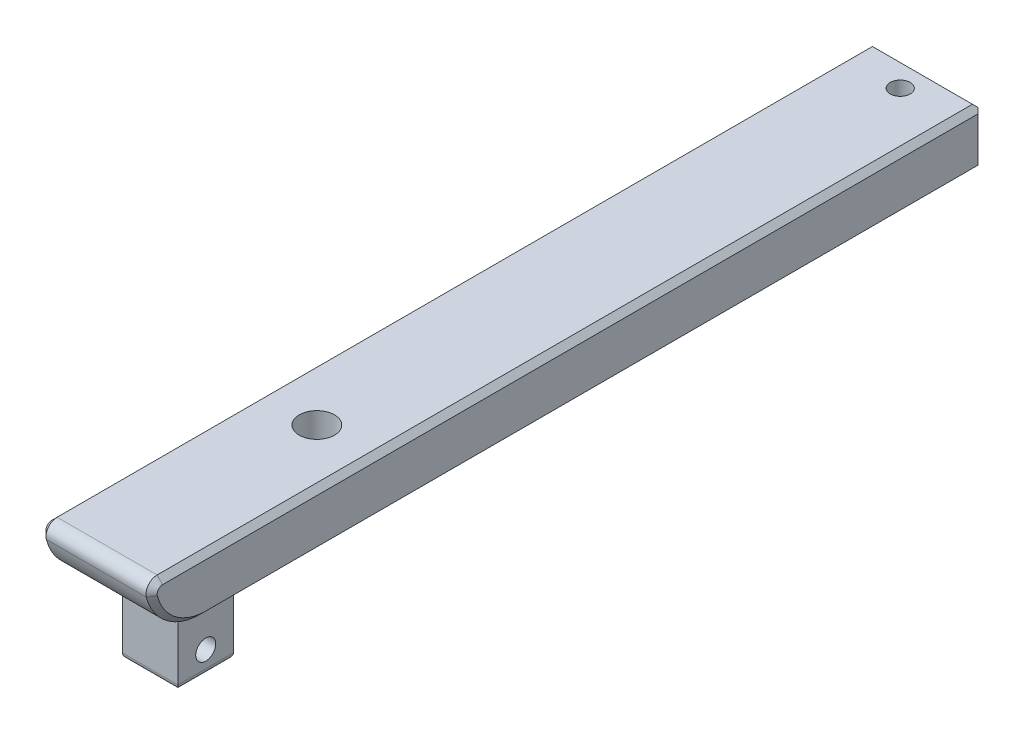
from build123d import *

# Parameters (mm, degrees)
SKETCH1_W                   = 20
SKETCH1_H                   = 150
BOSS_EXTRUDE1_DEPTH         = 10
M3_CLEARANCE_HOLE1_D        = 3.6
SKETCH3_W                   = 10
SKETCH3_H                   = 10
BOSS_EXTRUDE2_DEPTH         = 14
M3_CLEARANCE_HOLE5_D        = 3.6
F_1_4_0_25_DIAMETER_HOLE1_D = 6.35
FILLET1_R                   = 10
FILLET2_R                   = 2
CHAMFER1_SIZE               = 1
FILLET3_R                   = 1
CHAMFER2_SIZE               = 1


with BuildPart() as part:
    # Sketch1 → Boss-Extrude1 (new body)
    with BuildSketch(Plane(origin=(0, 0, 0), x_dir=(1, 0, 0), z_dir=(0, 1, 0))):
        with Locations((10, 75)):
            Rectangle(SKETCH1_W, SKETCH1_H)
    extrude(amount=BOSS_EXTRUDE1_DEPTH)

    # M3 Clearance Hole1 (through all)
    with Locations(Plane(origin=(10, 0, -145), x_dir=(0, 0, -1), z_dir=(0, -1, 0))):
        with Locations((0, 0)):
            Hole(M3_CLEARANCE_HOLE1_D / 2)

    # Sketch3 → Boss-Extrude2 (add)
    with BuildSketch(Plane.XZ):
        with Locations((10, -15)):
            Rectangle(SKETCH3_W, SKETCH3_H)
    extrude(amount=BOSS_EXTRUDE2_DEPTH)

    # M3 Clearance Hole5 (through all)
    with Locations(Plane(origin=(5, -10, -15), x_dir=(0, 0, -1), z_dir=(-1, 0, 0))):
        with Locations((0, 0)):
            Hole(M3_CLEARANCE_HOLE5_D / 2)

    # 1/4 (0.25) Diameter Hole1 (through all)
    with Locations(Plane(origin=(10, 0, -40), x_dir=(0, 0, -1), z_dir=(0, -1, 0))):
        with Locations((0, 0)):
            Hole(F_1_4_0_25_DIAMETER_HOLE1_D / 2)

    # Fillet1
    fillet1_edges = [part.edges().sort_by_distance(p)[0] for p in [
        (10, 0, 0),
    ]]
    fillet(fillet1_edges, radius=FILLET1_R - 0.0001)  # a hair under: the kernel refuses the full size

    # Fillet2
    fillet2_edges = [part.edges().sort_by_distance(p)[0] for p in [
        (10, 10, 0),
    ]]
    fillet(fillet2_edges, radius=FILLET2_R)

    # Chamfer1
    chamfer1_edges = [part.edges().sort_by_distance(p)[0] for p in [
        (20, 0, -79.99995),
        (0, 2.094314553, -3.876198607),
        (20, 10, -76.127005384),
        (0, 10, -76.127005384),
        (20, 2.094314553, -3.876198607),
        (20, 9.224752526, -0.672877867),
        (0, 9.224752526, -0.672877867),
        (0, 0, -79.99995),
        (0, 5, -150),
        (20, 5, -150),
    ]]
    chamfer(chamfer1_edges, length=CHAMFER1_SIZE)

    # Fillet3
    fillet3_edges = [part.edges().sort_by_distance(p)[0] for p in [
        (5, -14, -15),
        (10, -14, -20),
        (15, -14, -15),
        (10, -14, -10),
    ]]
    fillet(fillet3_edges, radius=FILLET3_R)

    # Chamfer2
    chamfer2_edges = [part.edges().sort_by_distance(p)[0] for p in [
        (10, 0, -150),
        (10, 10, -150),
    ]]
    chamfer(chamfer2_edges, length=CHAMFER2_SIZE)


solid = part.part
